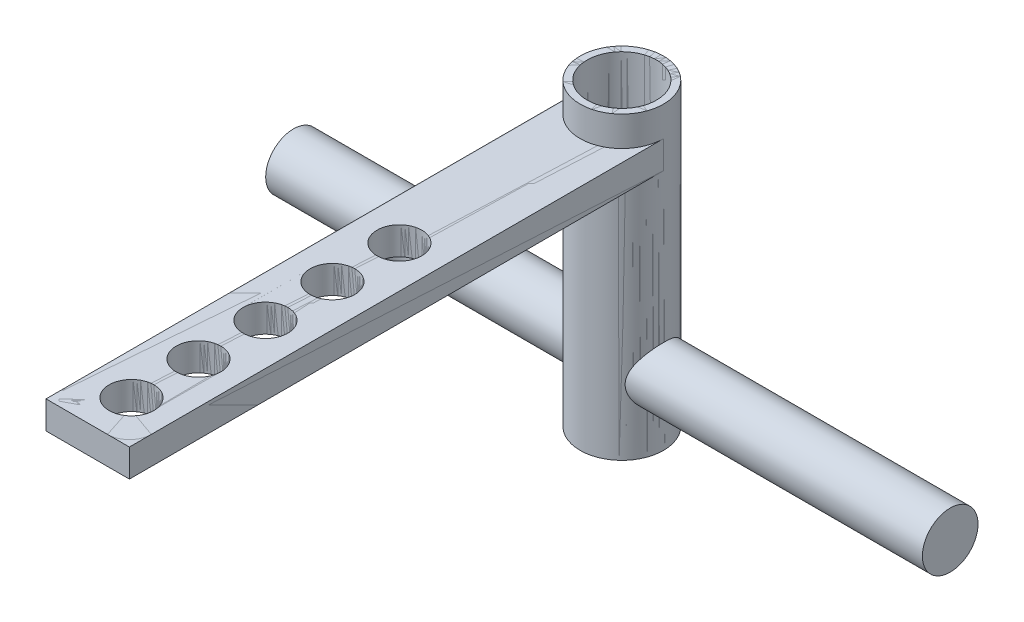
from build123d import *

# Parameters (mm, degrees)
SLEEVE_DEPTH       = 63.5
SLEEVE_DEPTH_BACK  = 5
SKETCH1_R          = 9.525
SKETCH2_W          = 19.05
SKETCH2_H          = 6.35
BRACKET_DEPTH      = 122
SKETCH4_R          = 5.1
BRACKET_HOLE_DEPTH = 138.86578845
SKETCH5_R          = 6.35
SHAFT_DEPTH        = 75
SKETCH6_R          = 7.9375
SLEEVE_HOLE_DEPTH  = 157.656471388
FILLET1_R          = 5


with BuildPart() as part:
    # Sketch1 → Sleeve (new, two sides: drawn at the far end of the back side and taken through both)
    with BuildSketch(Plane(origin=(0, 0, 0), x_dir=(1, 0, 0), z_dir=(0, 1, 0)).offset(-SLEEVE_DEPTH_BACK)):
        Circle(SKETCH1_R)
    extrude(amount=SLEEVE_DEPTH + SLEEVE_DEPTH_BACK)

    # Sketch2 → Bracket (add)
    with BuildSketch(Plane.XY):
        with Locations((0, 53.5)):
            Rectangle(SKETCH2_W, SKETCH2_H)
    extrude(amount=BRACKET_DEPTH)

    # Sketch4 → Bracket Hole (cut, through all)
    with BuildSketch(Plane(origin=(0, 0, 0), x_dir=(1, 0, 0), z_dir=(0, 1, 0))):
        with Locations((0, -50.8)):
            Circle(SKETCH4_R)
        with Locations((0, -66.1)):
            Circle(SKETCH4_R)
        with Locations((0, -81.4)):
            Circle(SKETCH4_R)
        with Locations((0, -96.7)):
            Circle(SKETCH4_R)
        with Locations((0, -112)):
            Circle(SKETCH4_R)
    extrude(amount=BRACKET_HOLE_DEPTH, mode=Mode.SUBTRACT)

    # Sketch5 → Shaft (add)
    with BuildSketch(Plane(origin=(0, 0, 0), x_dir=(0, 0, -1), z_dir=(1, 0, 0))):
        with Locations((0, 10)):
            Circle(SKETCH5_R)
    extrude(amount=SHAFT_DEPTH)

    # Sketch6 → Sleeve Hole (cut, through all)
    with BuildSketch(Plane(origin=(0, 0, 0), x_dir=(1, 0, 0), z_dir=(0, 1, 0))):
        Circle(SKETCH6_R)
    extrude(amount=SLEEVE_HOLE_DEPTH, mode=Mode.SUBTRACT)


with BuildPart() as body_2:
    # Mirror1: mirrored copy
    add(part.part.mirror(Plane(origin=(0, 0, 0), x_dir=(0, 0, 1), z_dir=(1, 0, 0))))

    # Fillet1
    fillet1_edges = [body_2.edges().sort_by_distance(p)[0] for p in [
        (-9.525, 53.5, 122),
        (9.525, 53.5, 122),
    ]]
    fillet(fillet1_edges, radius=FILLET1_R)


solid = Compound([part.part, body_2.part])
